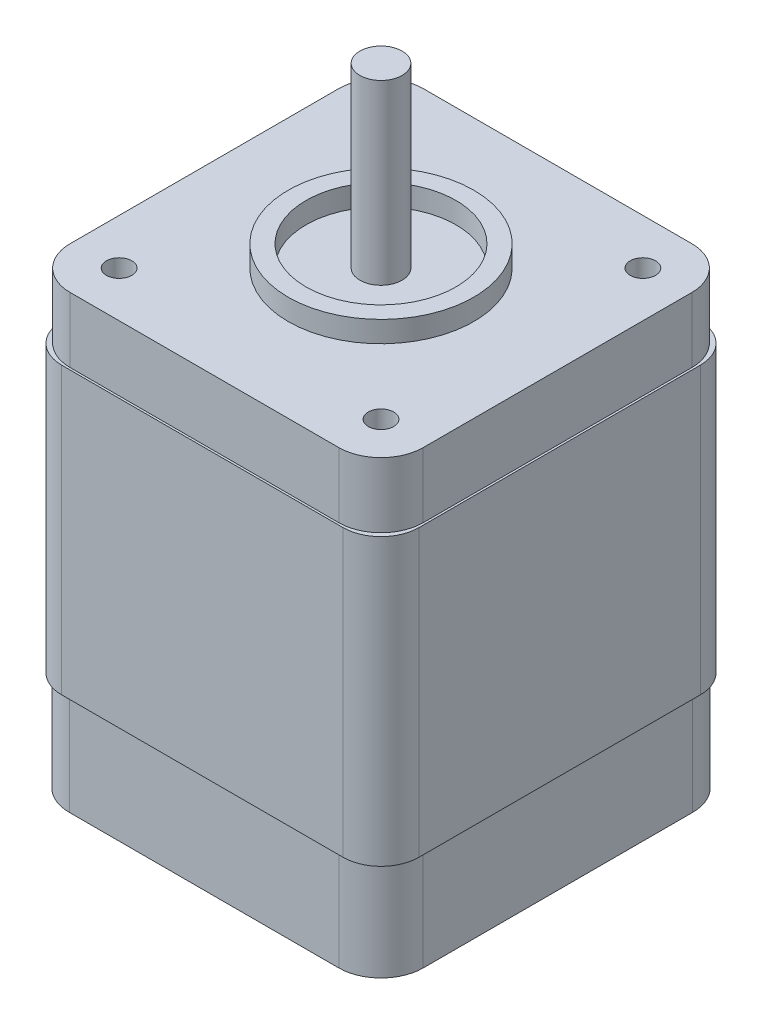
from build123d import *

# Parameters (mm, degrees)
SKETCH1_W           = 41.9
SKETCH1_H           = 41.9
BOSS_EXTRUDE1_DEPTH = 11.8
SKETCH2_W           = 42.3
SKETCH2_H           = 42.3
BOSS_EXTRUDE2_DEPTH = 33.8
SKETCH3_W           = 41.8
SKETCH3_H           = 41.8
BOSS_EXTRUDE3_DEPTH = 7.7
SKETCH4_R           = 10.98
SKETCH4_R_2         = 8.875
BOSS_EXTRUDE4_DEPTH = 2.5
FILLET1_R           = 5
FILLET3_R           = 4.5
SKETCH5_R           = 2.5
BOSS_EXTRUDE5_DEPTH = 21
SKETCH6_R           = 1.5
CUT_EXTRUDE1_DEPTH  = 5
SKETCH7_W           = 2.2
SKETCH7_H           = 27
BOSS_EXTRUDE6_DEPTH = 11.8
FILLET5_R           = 3


with BuildPart() as part:
    # Sketch1 → Boss-Extrude1 (new body)
    with BuildSketch(Plane(origin=(0, 0, 0), x_dir=(1, 0, 0), z_dir=(0, 1, 0))):
        Rectangle(SKETCH1_W, SKETCH1_H)
    extrude(amount=BOSS_EXTRUDE1_DEPTH)

    # Sketch2 → Boss-Extrude2 (add)
    with BuildSketch(Plane(origin=(0, 11.8, 0), x_dir=(1, 0, 0), z_dir=(0, 1, 0))):
        Rectangle(SKETCH2_W, SKETCH2_H)
    extrude(amount=BOSS_EXTRUDE2_DEPTH)

    # Sketch3 → Boss-Extrude3 (add)
    with BuildSketch(Plane(origin=(0, 45.6, 0), x_dir=(1, 0, 0), z_dir=(0, 1, 0))):
        Rectangle(SKETCH3_W, SKETCH3_H)
    extrude(amount=BOSS_EXTRUDE3_DEPTH)

    # Sketch4 → Boss-Extrude4 (add)
    with BuildSketch(Plane(origin=(0, 53.3, 0), x_dir=(1, 0, 0), z_dir=(0, 1, 0))):
        with Locations(Location((0, 0, 0), (0, 0, 270))):
            Circle(SKETCH4_R)
        with Locations(Location((0, 0, 0), (0, 0, 270))):
            Circle(SKETCH4_R_2, mode=Mode.SUBTRACT)
    extrude(amount=BOSS_EXTRUDE4_DEPTH)

    # Fillet1
    fillet1_edges = [part.edges().sort_by_distance(p)[0] for p in [
        (-20.9, 49.45, -20.9),
        (-20.9, 49.45, 20.9),
        (20.9, 49.45, 20.9),
        (20.9, 49.45, -20.9),
        (-20.95, 5.9, -20.95),
        (20.95, 5.9, -20.95),
        (20.95, 5.9, 20.95),
        (-20.95, 5.9, 20.95),
    ]]
    fillet(fillet1_edges, radius=FILLET1_R)

    # Fillet3
    fillet3_edges = [part.edges().sort_by_distance(p)[0] for p in [
        (-21.15, 28.7, -21.15),
        (-21.15, 28.7, 21.15),
        (21.15, 28.7, 21.15),
        (21.15, 28.7, -21.15),
    ]]
    fillet(fillet3_edges, radius=FILLET3_R)

    # Sketch5 → Boss-Extrude5 (add)
    with BuildSketch(Plane(origin=(0, 53.3, 0), x_dir=(1, 0, 0), z_dir=(0, 1, 0))):
        with Locations(Location((0, 0, 0), (0, 0, 90))):
            Circle(SKETCH5_R)
    extrude(amount=BOSS_EXTRUDE5_DEPTH)

    # Sketch6 → Cut-Extrude1 (cut)
    with BuildSketch(Plane(origin=(0, 53.3, 0), x_dir=(1, 0, 0), z_dir=(0, 1, 0))):
        with Locations(Location((-15.5, -15.5, 0), (0, 0, 270))):
            Circle(SKETCH6_R)
        with Locations(Location((-15.5, 15.5, 0), (0, 0, 270))):
            Circle(SKETCH6_R)
        with Locations(Location((15.5, 15.5, 0), (0, 0, 270))):
            Circle(SKETCH6_R)
        with Locations(Location((15.5, -15.5, 0), (0, 0, 270))):
            Circle(SKETCH6_R)
    extrude(amount=-CUT_EXTRUDE1_DEPTH, mode=Mode.SUBTRACT)

    # Sketch7 → Boss-Extrude6 (add)
    with BuildSketch(Plane.XZ):
        with Locations((-22.05, 0)):
            Rectangle(SKETCH7_W, SKETCH7_H)
    extrude(amount=-BOSS_EXTRUDE6_DEPTH)

    # Fillet5
    # the kernel refuses this fillet: 3 mm, written as the material it adds along each edge
    with BuildSketch(Plane(origin=(-20.95, 0, 13.5), x_dir=(0.0028347051318629093, 0, 0.9999959822153364), z_dir=(0, 1, 0))) as fillet5_piece_1:
        with BuildLine():
            CenterArc((2.886280715, -2.99582093), FILLET5_R, 93.02459513, 71.592016422)
            Line((-0.006236351, -2.199991161), (-0.295488058, -2.120408184))
            ThreePointArc((-0.295488058, -2.120408184), (-0.30311697, -1.099145169), (-0.299998795, 0.000850412))
            Line((-0.299998795, 0.000850412), (0.000850412, 0.299998795))
            ThreePointArc((0.000850412, 0.299998795), (2.450840568, 0.293053767), (2.712157439, 0.299582093))
            Line((2.712157439, 0.299582093), (2.727986828, 0))
        make_face()
    extrude(amount=11.8)
    with BuildSketch(Plane(origin=(-20.95, 0, -13.5), x_dir=(-1.0, 0, 2.215601439689644e-12), z_dir=(0, 1, 0))) as fillet5_piece_2:
        with BuildLine():
            CenterArc((2.987627139, -2.894761387), FILLET5_R, 105.22097159, 71.592016422)
            Line((-0.007733038, -2.727975867), (-0.307269056, -2.711297315))
            ThreePointArc((-0.307269056, -2.711297315), (-0.3, -2.45), (-0.3, 0))
            Line((-0.3, 0), (0, 0.3))
            ThreePointArc((0, 0.3), (1.1, 0.3), (2.121237286, 0.289476139))
            Line((2.121237286, 0.289476139), (2.2, 0))
        make_face()
    extrude(amount=11.8)


solid = part.part
